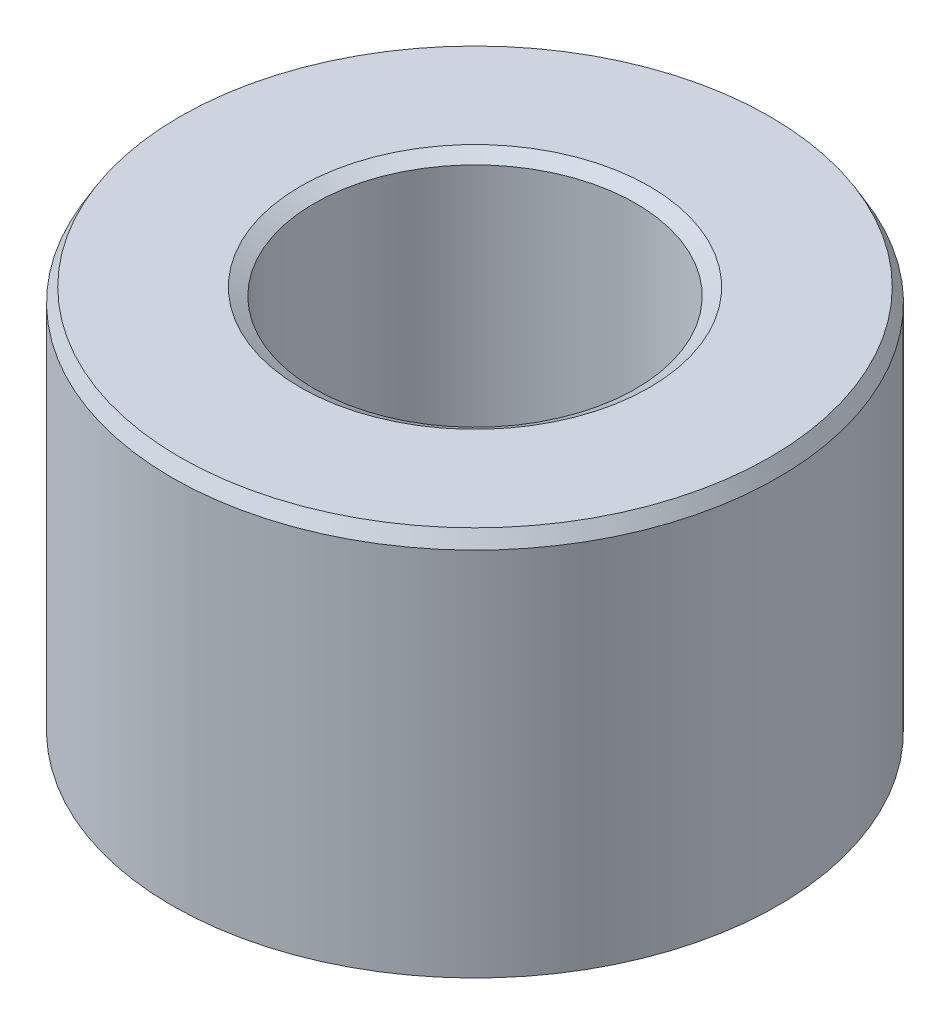
from build123d import *
from OCP.BRepFilletAPI import BRepFilletAPI_MakeChamfer

# Parameters (mm, degrees)
SKETCH1_R           = 7.5
BOSS_EXTRUDE1_DEPTH = 9.708725556
SKETCH2_R           = 3.977741364
CUT_EXTRUDE1_DEPTH  = 15.379129039
CHAMFER1_SIZE       = 0.339976843
CHAMFER1_SIZE2      = 0.196285722


with BuildPart() as part:
    # Sketch1 → Boss-Extrude1 (new body)
    with BuildSketch(Plane(origin=(0, 0, 0), x_dir=(1, 0, 0), z_dir=(0, 1, 0))):
        Circle(SKETCH1_R)
    extrude(amount=BOSS_EXTRUDE1_DEPTH)

    # Sketch2 → Cut-Extrude1 (cut, through all)
    with BuildSketch(Plane(origin=(0, 0, 0), x_dir=(1, 0, 0), z_dir=(0, 1, 0))):
        Circle(SKETCH2_R)
    extrude(amount=CUT_EXTRUDE1_DEPTH, mode=Mode.SUBTRACT)

    # Chamfer1: one chamfer whose edges measure the first distance from different faces: ONE call of the kernel's chamfer builder (chamfer() names one face for all edges)
    chamfer1_edges_1 = [part.edges().sort_by_distance(p)[0] for p in [
        (-3.977741364, 9.708725556, 0),
    ]]
    chamfer1_side_1 = [part.faces().sort_by_distance(p)[0] for p in [
        (-7.287867966, 9.708725556, 0),
    ]]
    chamfer1_edges_2 = [part.edges().sort_by_distance(p)[0] for p in [
        (-3.977741364, 0, 0),
    ]]
    chamfer1_side_2 = [part.faces().sort_by_distance(p)[0] for p in [
        (-3.977741364, 4.854362778, 0),
    ]]
    chamfer1_edges_3 = [part.edges().sort_by_distance(p)[0] for p in [
        (-7.5, 0, 0),
    ]]
    chamfer1_side_3 = [part.faces().sort_by_distance(p)[0] for p in [
        (-7.287867966, 0, 0),
    ]]
    chamfer1_edges_4 = [part.edges().sort_by_distance(p)[0] for p in [
        (-7.5, 9.708725556, 0),
    ]]
    chamfer1_side_4 = [part.faces().sort_by_distance(p)[0] for p in [
        (-7.5, 4.854362778, 0),
    ]]
    chamfer1 = BRepFilletAPI_MakeChamfer(part.part.solid().wrapped)
    for e in chamfer1_edges_1:
        chamfer1.Add(CHAMFER1_SIZE, CHAMFER1_SIZE2, e.wrapped, chamfer1_side_1[0].wrapped)  # the first distance lies on this face
    for e in chamfer1_edges_2:
        chamfer1.Add(CHAMFER1_SIZE, CHAMFER1_SIZE2, e.wrapped, chamfer1_side_2[0].wrapped)  # the first distance lies on this face
    for e in chamfer1_edges_3:
        chamfer1.Add(CHAMFER1_SIZE, CHAMFER1_SIZE2, e.wrapped, chamfer1_side_3[0].wrapped)  # the first distance lies on this face
    for e in chamfer1_edges_4:
        chamfer1.Add(CHAMFER1_SIZE, CHAMFER1_SIZE2, e.wrapped, chamfer1_side_4[0].wrapped)  # the first distance lies on this face
    add(Compound.cast(chamfer1.Shape()), mode=Mode.REPLACE)


solid = part.part
